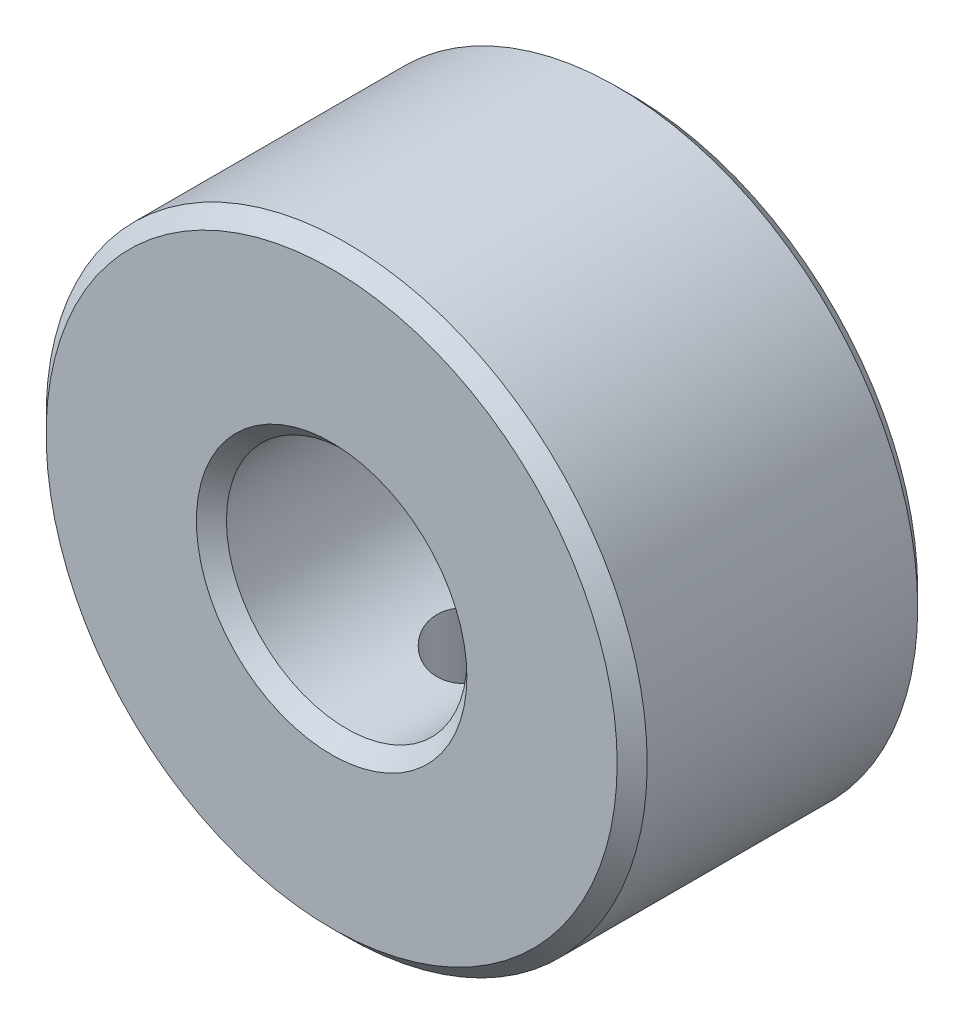
from build123d import *

# Parameters (mm, degrees)
SKETCH1_R          = 10
SKETCH1_R_2        = 4
BASE_EXTRUDE_DEPTH = 10
CHAMFER1_SIZE      = 0.5
SKETCH2_R          = 1.5
HOLE_DEPTH         = 18.320508076
CHAMFER2_SIZE      = 0.5


with BuildPart() as part:
    # Sketch1 → Base-Extrude (new body)
    with BuildSketch(Plane.XY):
        Circle(SKETCH1_R)
        Circle(SKETCH1_R_2, mode=Mode.SUBTRACT)
    extrude(amount=-BASE_EXTRUDE_DEPTH)

    # Chamfer1
    chamfer1_edges = [part.edges().sort_by_distance(p)[0] for p in [
        (-10, 0, -10),
        (-10, 0, 0),
    ]]
    chamfer(chamfer1_edges, length=CHAMFER1_SIZE)

    # Sketch2 → Hole (cut, through all)
    with BuildSketch(Plane(origin=(0, 0, 0), x_dir=(1, 0, 0), z_dir=(0, 1, 0))):
        with Locations((0, 5)):
            Circle(SKETCH2_R)
    extrude(amount=-HOLE_DEPTH, mode=Mode.SUBTRACT)

    # Chamfer2
    chamfer2_edges = [part.edges().sort_by_distance(p)[0] for p in [
        (-4, 0, 0),
        (-4, 0, -10),
    ]]
    chamfer(chamfer2_edges, length=CHAMFER2_SIZE)


solid = part.part
